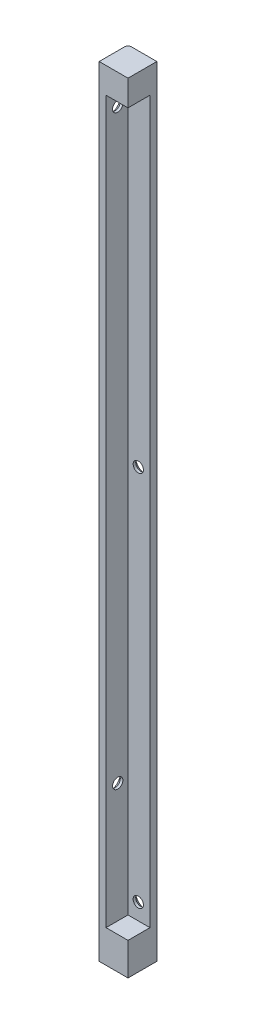
from build123d import *

# Parameters (mm, degrees)
BOSS_EXTRUDE1_DEPTH                                 = 221.5
CSK_FOR_M3_COUNTERSUNK_FLAT_HEAD_SCREW1_D           = 3
CSK_FOR_M3_COUNTERSUNK_FLAT_HEAD_SCREW1_CSINK_D     = 5.5
CSK_FOR_M3_COUNTERSUNK_FLAT_HEAD_SCREW1_CSINK_ANGLE = 90
CSK_FOR_M3_COUNTERSUNK_FLAT_HEAD_SCREW4_D           = 3
CSK_FOR_M3_COUNTERSUNK_FLAT_HEAD_SCREW4_CSINK_D     = 5.5
CSK_FOR_M3_COUNTERSUNK_FLAT_HEAD_SCREW4_CSINK_ANGLE = 90
SKETCH12_W                                          = 8
SKETCH12_H                                          = 7
BOSS_EXTRUDE2_DEPTH                                 = 5.5
CUT_EXTRUDE1_DEPTH                                  = 359
BOSS_EXTRUDE3_DEPTH                                 = 3
BOSS_EXTRUDE4_DEPTH                                 = 2.5
BOSS_EXTRUDE4_DEPTH_BACK                            = 6
SKETCH19_W                                          = 0.6
SKETCH19_H                                          = 227
CUT_EXTRUDE2_DEPTH                                  = 10
SKETCH20_W                                          = 15.604741464
SKETCH20_H                                          = 2
CUT_EXTRUDE3_DEPTH                                  = 10
SKETCH21_W                                          = 0.6
SKETCH21_H                                          = 225
CUT_EXTRUDE4_DEPTH                                  = 10
SKETCH22_W                                          = 8.4
SKETCH22_H                                          = 5.5
CUT_EXTRUDE5_DEPTH                                  = 10
BOSS_EXTRUDE5_DEPTH                                 = 2
BOSS_EXTRUDE6_DEPTH                                 = 221.5
FILLET1_R                                           = 1
BOSS_EXTRUDE7_START                                 = 4.5
BOSS_EXTRUDE7_DEPTH                                 = 4.5
BOSS_EXTRUDE8_DEPTH                                 = 1


with BuildPart() as part:
    # Sketch1 → Boss-Extrude1 (new body)
    with BuildSketch(Plane(origin=(0, 0, 0), x_dir=(1, 0, 0), z_dir=(0, 1, 0))):
        Polygon((0, 0), (0, 9), (9, 9), (9, 7), (2, 7), (2, 0), align=None)
    extrude(amount=BOSS_EXTRUDE1_DEPTH)

    # CSK for M3 Countersunk Flat Head Screw1 (through all)
    with Locations(Plane.ZY):
        with Locations((-4, 211), (-4, 40.25)):
            CounterSinkHole(CSK_FOR_M3_COUNTERSUNK_FLAT_HEAD_SCREW1_D / 2, CSK_FOR_M3_COUNTERSUNK_FLAT_HEAD_SCREW1_CSINK_D / 2, counter_sink_angle=CSK_FOR_M3_COUNTERSUNK_FLAT_HEAD_SCREW1_CSINK_ANGLE)

    # CSK for M3 Countersunk Flat Head Screw4 (through all)
    with Locations(Plane(origin=(0, 0, -9), x_dir=(-1, 0, 0), z_dir=(0, 0, -1))):
        with Locations((-5, 10.25), (-5, 120)):
            CounterSinkHole(CSK_FOR_M3_COUNTERSUNK_FLAT_HEAD_SCREW4_D / 2, CSK_FOR_M3_COUNTERSUNK_FLAT_HEAD_SCREW4_CSINK_D / 2, counter_sink_angle=CSK_FOR_M3_COUNTERSUNK_FLAT_HEAD_SCREW4_CSINK_ANGLE)

    # Sketch12 → Boss-Extrude2 (add)
    with BuildSketch(Plane.XZ):
        with Locations((5, -3.5)):
            Rectangle(SKETCH12_W, SKETCH12_H)
    extrude(amount=-BOSS_EXTRUDE2_DEPTH)

    # Sketch13 → Cut-Extrude1 (cut)
    with BuildSketch(Plane(origin=(0, 221.5, 0), x_dir=(1, 0, 0), z_dir=(0, 1, 0))):
        Polygon((0, 8), (1, 9), (0, 9), align=None)
    extrude(amount=-CUT_EXTRUDE1_DEPTH, mode=Mode.SUBTRACT)

    # Sketch14 → Boss-Extrude3 (add)
    with BuildSketch(Plane.XZ):
        Polygon((0, 0), (9, 0), (9, -9), (1, -9), (0, -8), align=None)
    extrude(amount=BOSS_EXTRUDE3_DEPTH)

    # Sketch18 → Boss-Extrude4 (add, two sides: drawn at the far end of the back side and taken through both)
    with BuildSketch(Plane(origin=(0, 221.5, 0), x_dir=(1, 0, 0), z_dir=(0, 1, 0)).offset(-BOSS_EXTRUDE4_DEPTH_BACK)):
        Polygon((0, 0), (9, 0), (9, 9), (1, 9), (0, 8), align=None)
    extrude(amount=BOSS_EXTRUDE4_DEPTH + BOSS_EXTRUDE4_DEPTH_BACK)

    # Sketch19 → Cut-Extrude2 (cut)
    with BuildSketch(Plane.ZY):
        with Locations((-0.3, 110.5)):
            Rectangle(SKETCH19_W, SKETCH19_H)
    extrude(amount=-CUT_EXTRUDE2_DEPTH, mode=Mode.SUBTRACT)

    # Sketch20 → Cut-Extrude3 (cut)
    with BuildSketch(Plane.ZY):
        with Locations((-8.402370732, 223)):
            Rectangle(SKETCH20_W, SKETCH20_H)
    extrude(amount=-CUT_EXTRUDE3_DEPTH, mode=Mode.SUBTRACT)

    # Sketch21 → Cut-Extrude4 (cut)
    with BuildSketch(Plane(origin=(0, 0, -9), x_dir=(-1, 0, 0), z_dir=(0, 0, -1))):
        with Locations((-8.7, 109.5)):
            Rectangle(SKETCH21_W, SKETCH21_H)
    extrude(amount=-CUT_EXTRUDE4_DEPTH, mode=Mode.SUBTRACT)

    # Sketch22 → Cut-Extrude5 (cut)
    with BuildSketch(Plane(origin=(0, 0, -9), x_dir=(-1, 0, 0), z_dir=(0, 0, -1))):
        with Locations((-4.2, -0.25)):
            Rectangle(SKETCH22_W, SKETCH22_H)
    extrude(amount=-CUT_EXTRUDE5_DEPTH, mode=Mode.SUBTRACT)

    # Sketch26 → Boss-Extrude5 (add)
    with BuildSketch(Plane.XZ.offset(-2.5)):
        Polygon((8.4, -9), (8.4, -0.6), (0, -0.6), (0, -8), (1, -9), align=None)
    extrude(amount=BOSS_EXTRUDE5_DEPTH)

    # Sketch29 → Boss-Extrude6 (add)
    with BuildSketch(Plane(origin=(0, 222, 0), x_dir=(1, 0, 0), z_dir=(0, 1, 0))):
        Polygon((0, 8), (1, 9), (0, 9), align=None)
    extrude(amount=-BOSS_EXTRUDE6_DEPTH)

    # Fillet1
    fillet1_edges = [part.edges().sort_by_distance(p)[0] for p in [
        (0, 111.25, -9),
    ]]
    fillet(fillet1_edges, radius=FILLET1_R)

    # Sketch30 → Boss-Extrude7 (add)
    with BuildSketch(Plane.XZ.offset(-0.5).offset(BOSS_EXTRUDE7_START)):
        with BuildLine():
            Line((0, -8), (0, -0.6))
            Line((0, -0.6), (8.4, -0.6))
            Line((8.4, -0.6), (8.4, -9))
            Line((8.4, -9), (1, -9))
            ThreePointArc((1, -9), (0.292893219, -8.707106781), (0, -8))
        make_face()
    extrude(amount=-BOSS_EXTRUDE7_DEPTH)

    # Sketch31 → Boss-Extrude8 (add)
    with BuildSketch(Plane(origin=(0, 222, 0), x_dir=(1, 0, 0), z_dir=(0, 1, 0))):
        with BuildLine():
            Line((0, 0.6), (8.4, 0.6))
            Line((8.4, 0.6), (8.4, 9))
            Line((8.4, 9), (1, 9))
            ThreePointArc((1, 9), (0.292893219, 8.707106781), (0, 8))
            Line((0, 8), (0, 0.6))
        make_face()
    extrude(amount=BOSS_EXTRUDE8_DEPTH)


solid = part.part
